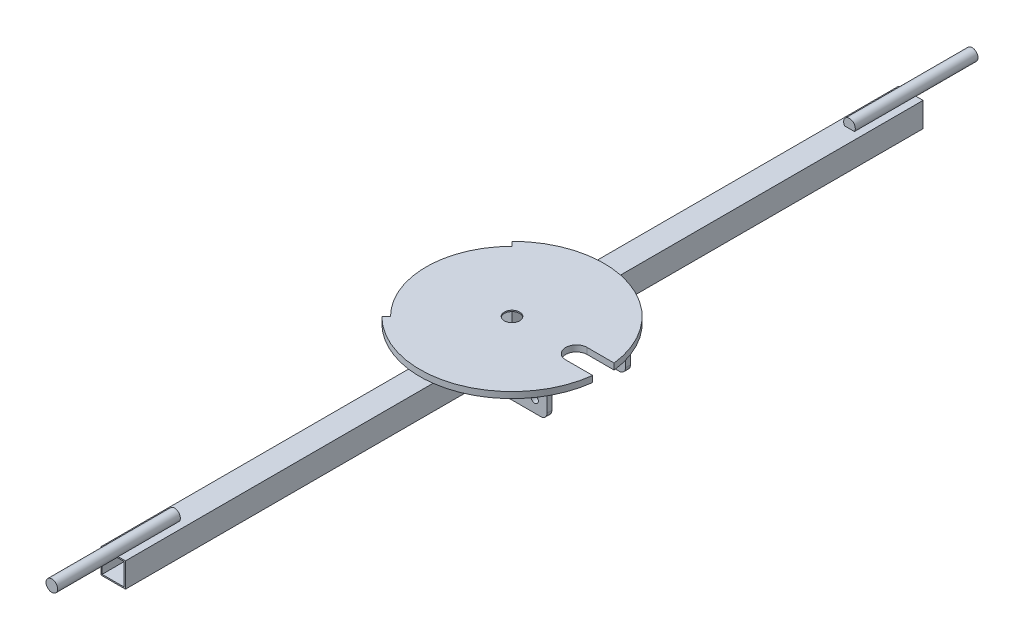
from build123d import *

# Parameters (mm, degrees)
SKETCH1_W            = 40
SKETCH1_H            = 40
BOSS_EXTRUDE1_DEPTH  = 650
BOSS_EXTRUDE2_START  = 550
SKETCH3_R            = 9.5
BOSS_EXTRUDE2_DEPTH  = 200
SKETCH8_R            = 150
BOSS_EXTRUDE3_DEPTH  = 10
SKETCH9_W            = 105
SKETCH9_H            = 8
SKETCH9_H_2          = 40
BOSS_EXTRUDE4_DEPTH  = 40
FILLET1_R            = 10
SKETCH10_R           = 6
CUT_EXTRUDE1_DEPTH   = 735.31209305
CUT_EXTRUDE2_DEPTH   = 767.485485838
CUT_EXTRUDE5_DEPTH   = 767.485485838
SHELL2_START         = -18
SHELL2_DEPTH         = 36
SHELL2_START_2       = 22
SHELL2_2_DEPTH       = 6
SHELL2_START_3       = 8.0000001
SHELL2_3_DEPTH       = 13.9999999
SHELL2_START_4       = -10
SHELL2_4_DEPTH       = 1.9999999
SHELL2_START_5       = -552
SHELL2_5_OUTLINE_W   = 36
SHELL2_5_OUTLINE_H   = 8
SHELL2_5_OUTLINE_H_2 = 16.0000002
SHELL2_5_DEPTH       = 1300
SHELL2_6_OUTLINE_W   = 105
SHELL2_6_OUTLINE_H   = 8
SHELL2_6_OUTLINE_H_2 = 16.0000002
SHELL2_6_DEPTH       = 36
SHELL2_START_6       = -748
SHELL2_7_OUTLINE_R   = 7.5
SHELL2_7_DEPTH       = 196
SHELL2_START_7       = 552
SHELL2_8_DEPTH       = 196
SHELL2_START_8       = -66
SHELL2_9_DEPTH       = 4
SHELL2_START_9       = 62
SHELL2_10_DEPTH      = 4
SKETCH12_R           = 12.5
CUT_EXTRUDE3_DEPTH   = 70
SKETCH13_W           = 30
SKETCH13_H           = 30
CUT_EXTRUDE4_DEPTH   = 20


with BuildPart() as part:
    # Sketch1 → Boss-Extrude1 (new, symmetric)
    with BuildSketch(Plane.XY):
        Rectangle(SKETCH1_W, SKETCH1_H)
    extrude(amount=BOSS_EXTRUDE1_DEPTH, both=True)

    # Sketch3 → Boss-Extrude2 (add)
    with BuildSketch(Plane.XY.offset(BOSS_EXTRUDE2_START)):
        with Locations(Location((0, 25, 0), (0, 0, 211.756863859))):
            Circle(SKETCH3_R)
    boss_extrude2 = extrude(amount=BOSS_EXTRUDE2_DEPTH)

    # Sketch8 → Boss-Extrude3 (add)
    with BuildSketch(Plane(origin=(0, 20, 0), x_dir=(1, 0, 0), z_dir=(0, 1, 0))):
        with Locations(Location((0, 0, 0), (0, 0, 277.662255661))):
            Circle(SKETCH8_R)
    extrude(amount=BOSS_EXTRUDE3_DEPTH)

    # Sketch9 → Boss-Extrude4 (add)
    with BuildSketch(Plane.XZ.offset(-20)):
        with Locations((72.5, -64)):
            Rectangle(SKETCH9_W, SKETCH9_H)
        with Locations((72.5, 64)):
            Rectangle(SKETCH9_W, SKETCH9_H)
        with Locations((-72.5, 0)):
            Rectangle(SKETCH9_W, SKETCH9_H_2)
    extrude(amount=BOSS_EXTRUDE4_DEPTH)

    # Fillet1
    fillet1_edges = [part.edges().sort_by_distance(p)[0] for p in [
        (125, -20, -64),
        (125, -20, 64),
    ]]
    fillet(fillet1_edges, radius=FILLET1_R)

    # Sketch10 → Cut-Extrude1 (cut, through all)
    with BuildSketch(Plane.XY.offset(68)):
        with Locations((105, 0)):
            Circle(SKETCH10_R)
    extrude(amount=-CUT_EXTRUDE1_DEPTH, mode=Mode.SUBTRACT)

    # Sketch11 → Cut-Extrude2 (cut, through all)
    with BuildSketch(Plane(origin=(0, 30, 0), x_dir=(1, 0, 0), z_dir=(0, 1, 0))):
        with BuildLine():
            Line((105, 17.5), (150, 17.5))
            Line((150, 17.5), (150, -17.5))
            Line((150, -17.5), (105, -17.5))
            ThreePointArc((105, -17.5), (87.5, 0), (105, 17.5))
        make_face()
    extrude(amount=-CUT_EXTRUDE2_DEPTH, mode=Mode.SUBTRACT)

    # Mirror1: Boss-Extrude2 across plane
    add(boss_extrude2.mirror(Plane.XY))

    # Sketch14 → Cut-Extrude5 (cut, through all)
    with BuildSketch(Plane(origin=(0, 30, 0), x_dir=(1, 0, 0), z_dir=(0, 1, 0))):
        with BuildLine():
            Line((-106.066017178, 106.066017178), (-98.994949366, 98.994949366))
            ThreePointArc((-98.994949366, 98.994949366), (-140, 0), (-98.994949366, -98.994949366))
            Line((-98.994949366, -98.994949366), (-106.066017178, -106.066017178))
            ThreePointArc((-106.066017178, -106.066017178), (-150, 0), (-106.066017178, 106.066017178))
        make_face()
    extrude(amount=-CUT_EXTRUDE5_DEPTH, mode=Mode.SUBTRACT)

    # Shell2: read off the stored shape, not the designer's step
    # Shell2 outline → Shell2 (cut)
    with BuildSketch(Plane(origin=(0, 0, 0), x_dir=(1, 0, 0), z_dir=(0, 1, 0)).offset(SHELL2_START)):
        with BuildLine():
            Line((-18, 648), (-18, 146.901327428))
            ThreePointArc((-18, 146.901327428), (0, 148), (18, 146.901327428))
            Line((18, 146.901327428), (18, 648))
            Line((18, 648), (-18, 648))
        make_face()
        with BuildLine():
            ThreePointArc((18, -146.901327428), (0, -148), (-18, -146.901327428))
            Line((-18, -146.901327428), (-18, -650))
            Line((-18, -650), (18, -650))
            Line((18, -650), (18, -146.901327428))
        make_face()
    extrude(amount=SHELL2_DEPTH, mode=Mode.SUBTRACT)

    # Shell2 2 outline → Shell2 2 (cut)
    with BuildSketch(Plane(origin=(0, 0, 0), x_dir=(1, 0, 0), z_dir=(0, 1, 0)).offset(SHELL2_START_2)):
        with BuildLine():
            Line((-103.22803412, 106.056461245), (-96.156273779, 98.984700904))
            ThreePointArc((-96.156273779, 98.984700904), (-138, 0), (-96.156273779, -98.984700904))
            Line((-96.156273779, -98.984700904), (-103.22803412, -106.056461245))
            ThreePointArc((-103.22803412, -106.056461245), (48.432118419, -139.85109905), (146.709747461, -19.5))
            Line((146.709747461, -19.5), (105, -19.5))
            ThreePointArc((105, -19.5), (85.5, 0), (105, 19.5))
            Line((105, 19.5), (146.709747461, 19.5))
            ThreePointArc((146.709747461, 19.5), (48.432118419, 139.85109905), (-103.22803412, 106.056461245))
        make_face()
    extrude(amount=SHELL2_2_DEPTH, mode=Mode.SUBTRACT)

    # Shell2 3 outline → Shell2 3 (cut)
    with BuildSketch(Plane(origin=(0, 0, 0), x_dir=(1, 0, 0), z_dir=(0, 1, 0)).offset(SHELL2_START_3)):
        with BuildLine():
            ThreePointArc((18, 146.901327428), (0, 148), (-18, 146.901327428))
            Line((-18, 146.901327428), (-18, 18))
            Line((-18, 18), (-123, 18))
            Line((-123, 18), (-123, -18))
            Line((-123, -18), (-18, -18))
            Line((-18, -18), (-18, -146.901327428))
            ThreePointArc((-18, -146.901327428), (0, -148), (18, -146.901327428))
            Line((18, -146.901327428), (18, -66))
            Line((18, -66), (123, -66))
            Line((123, -66), (123, -62))
            Line((123, -62), (18, -62))
            Line((18, -62), (18, 62))
            Line((18, 62), (123, 62))
            Line((123, 62), (123, 66))
            Line((123, 66), (18, 66))
            Line((18, 66), (18, 146.901327428))
        make_face()
    extrude(amount=SHELL2_3_DEPTH, mode=Mode.SUBTRACT)

    # Shell2 4 outline → Shell2 4 (cut)
    with BuildSketch(Plane(origin=(0, 0, 0), x_dir=(1, 0, 0), z_dir=(0, 1, 0)).offset(SHELL2_START_4)):
        with BuildLine():
            ThreePointArc((18, 146.901327428), (0, 148), (-18, 146.901327428))
            Line((-18, 146.901327428), (-18, 18))
            Line((-18, 18), (-123, 18))
            Line((-123, 18), (-123, -18))
            Line((-123, -18), (-18, -18))
            Line((-18, -18), (-18, -146.901327428))
            ThreePointArc((-18, -146.901327428), (0, -148), (18, -146.901327428))
            Line((18, -146.901327428), (18, -66))
            Line((18, -66), (123, -66))
            Line((123, -66), (123, -62))
            Line((123, -62), (18, -62))
            Line((18, -62), (18, 62))
            Line((18, 62), (123, 62))
            Line((123, 62), (123, 66))
            Line((123, 66), (18, 66))
            Line((18, 66), (18, 146.901327428))
        make_face()
    extrude(amount=SHELL2_4_DEPTH, mode=Mode.SUBTRACT)

    # Shell2 5 outline → Shell2 5 (cut)
    with BuildSketch(Plane.XY.offset(SHELL2_START_5)):
        with Locations((0, -14)):
            Rectangle(SHELL2_5_OUTLINE_W, SHELL2_5_OUTLINE_H)
        Rectangle(SHELL2_5_OUTLINE_W, SHELL2_5_OUTLINE_H_2)
        with BuildLine():
            Line((2.692582404, 18), (-2.692582404, 18))
            ThreePointArc((-2.692582404, 18), (0, 17.5), (2.692582404, 18))
        make_face()
    extrude(amount=SHELL2_5_DEPTH, mode=Mode.SUBTRACT)

    # Shell2 6 outline → Shell2 6 (cut)
    with BuildSketch(Plane.XY.offset(SHELL2_START)):
        with Locations((-70.5, -14)):
            Rectangle(SHELL2_6_OUTLINE_W, SHELL2_6_OUTLINE_H)
        with Locations((-70.5, 0)):
            Rectangle(SHELL2_6_OUTLINE_W, SHELL2_6_OUTLINE_H_2)
    extrude(amount=SHELL2_6_DEPTH, mode=Mode.SUBTRACT)

    # Shell2 7 outline → Shell2 7 (cut)
    with BuildSketch(Plane.XY.offset(SHELL2_START_6)):
        with Locations((0, 25)):
            Circle(SHELL2_7_OUTLINE_R)
    extrude(amount=SHELL2_7_DEPTH, mode=Mode.SUBTRACT)

    # Shell2 8 outline → Shell2 8 (cut)
    with BuildSketch(Plane.XY.offset(SHELL2_START_7)):
        with BuildLine():
            ThreePointArc((2.692582404, 18), (0, 32.5), (-2.692582404, 18))
            Line((-2.692582404, 18), (2.692582404, 18))
        make_face()
    extrude(amount=SHELL2_8_DEPTH, mode=Mode.SUBTRACT)

    # Shell2 9 outline → Shell2 9 (cut)
    with BuildSketch(Plane.XY.offset(SHELL2_START_8)):
        with BuildLine():
            Line((18, -10), (18, -18))
            Line((18, -18), (115, -18))
            ThreePointArc((115, -18), (120.656854249, -15.656854249), (123, -10))
            Line((123, -10), (18, -10))
        make_face()
        with BuildLine():
            Line((18, 8.0000001), (18, -8.0000001))
            Line((18, -8.0000001), (105, -8))
            ThreePointArc((105, -8), (97, 0), (105, 8))
            Line((105, 8), (18, 8.0000001))
        make_face()
        with BuildLine():
            ThreePointArc((105, 8), (113, 0), (105, -8))
            Line((105, -8), (123, -8.0000001))
            Line((123, -8.0000001), (123, 8.0000001))
            Line((123, 8.0000001), (105, 8))
        make_face()
    extrude(amount=SHELL2_9_DEPTH, mode=Mode.SUBTRACT)

    # Shell2 10 outline → Shell2 10 (cut)
    with BuildSketch(Plane.XY.offset(SHELL2_START_9)):
        with BuildLine():
            Line((18, -10), (18, -18))
            Line((18, -18), (115, -18))
            ThreePointArc((115, -18), (120.656854249, -15.656854249), (123, -10))
            Line((123, -10), (18, -10))
        make_face()
        with BuildLine():
            Line((18, 8.0000001), (18, -8.0000001))
            Line((18, -8.0000001), (105, -8))
            ThreePointArc((105, -8), (97, 0), (105, 8))
            Line((105, 8), (18, 8.0000001))
        make_face()
        with BuildLine():
            ThreePointArc((105, 8), (113, 0), (105, -8))
            Line((105, -8), (123, -8.0000001))
            Line((123, -8.0000001), (123, 8.0000001))
            Line((123, 8.0000001), (105, 8))
        make_face()
    extrude(amount=SHELL2_10_DEPTH, mode=Mode.SUBTRACT)

    # Sketch12 → Cut-Extrude3 (cut)
    with BuildSketch(Plane(origin=(0, 30, 0), x_dir=(1, 0, 0), z_dir=(0, 1, 0))):
        with Locations(Location((0, 0, 0), (0, 0, 180))):
            Circle(SKETCH12_R)
    extrude(amount=-CUT_EXTRUDE3_DEPTH, mode=Mode.SUBTRACT)

    # Sketch13 → Cut-Extrude4 (cut)
    with BuildSketch(Plane.XZ.offset(20)):
        Rectangle(SKETCH13_W, SKETCH13_H)
    extrude(amount=-CUT_EXTRUDE4_DEPTH, mode=Mode.SUBTRACT)


solid = part.part
